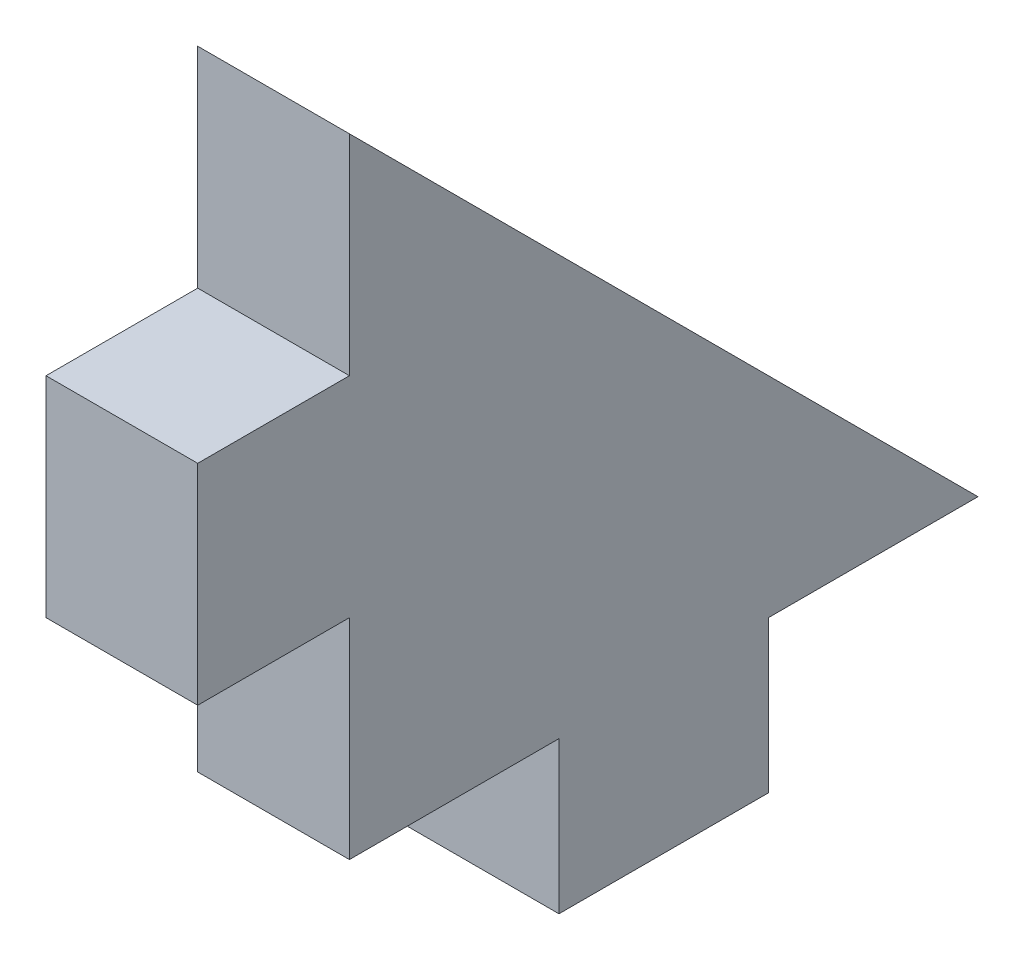
from build123d import *

# Parameters (mm, degrees)
BOSS_EXTRUDE1_DEPTH = 5.12


with BuildPart() as part:
    # Sketch1 → Boss-Extrude1 (new body)
    with BuildSketch(Plane(origin=(0, 0, 0), x_dir=(0, 0, -1), z_dir=(1, 0, 0))):
        Polygon((0, 21.213203436), (21.213203436, 0), (14.142135624, 0), (14.142135624, -5.12), (7.071067812, -5.12), (7.071067812, 0), (0, 0), (0, 7.071067812), (-5.12, 7.071067812), (-5.12, 14.142135624), (0, 14.142135624), align=None)
    extrude(amount=BOSS_EXTRUDE1_DEPTH)


solid = part.part
